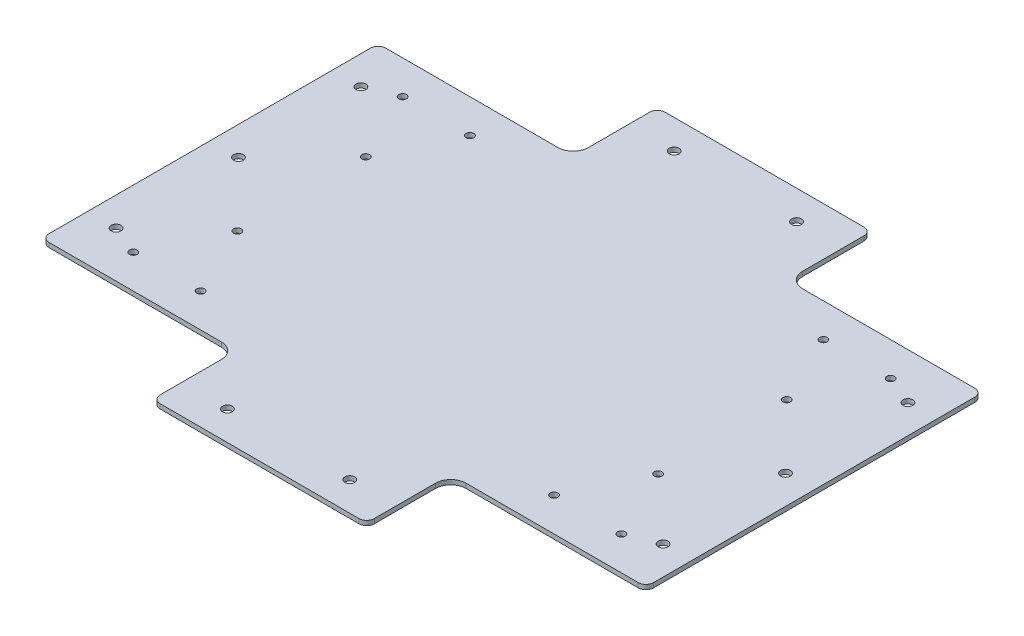
from build123d import *

# Parameters (mm, degrees)
SKETCH_1_R      = 2.5
SKETCH_1_R_2    = 3.2
EXTRUDE_1_DEPTH = 3


with BuildPart() as part:
    # Эскиз1 → Бобышка-Вытянуть1 (new body)
    with BuildSketch(Plane(origin=(0, 0, 0), x_dir=(1, 0, 0), z_dir=(0, 1, 0))):
        with BuildLine():
            ThreePointArc((-70, -160), (-68.535533906, -163.535533906), (-65, -165))
            Line((-65, -165), (65, -165))
            ThreePointArc((65, -165), (68.535533906, -163.535533906), (70, -160))
            Line((70, -160), (70, -120))
            ThreePointArc((70, -120), (72.928932188, -112.928932188), (80, -110))
            Line((80, -110), (134.901841239, -110))
            Line((134.901841239, -110), (160.901841239, -110))
            Line((160.901841239, -110), (192.5, -110))
            ThreePointArc((192.5, -110), (196.035533906, -108.535533906), (197.5, -105))
            Line((197.5, -105), (197.5, 105))
            ThreePointArc((197.5, 105), (196.035533906, 108.535533906), (192.5, 110))
            Line((192.5, 110), (160.901841239, 110))
            Line((160.901841239, 110), (134.901841239, 110))
            Line((134.901841239, 110), (80, 110))
            ThreePointArc((80, 110), (72.928932188, 112.928932188), (70, 120))
            Line((70, 120), (70, 160))
            ThreePointArc((70, 160), (68.535533906, 163.535533906), (65, 165))
            Line((65, 165), (-65, 165))
            ThreePointArc((-65, 165), (-68.535533906, 163.535533906), (-70, 160))
            Line((-70, 160), (-70, 120))
            ThreePointArc((-70, 120), (-72.928932188, 112.928932188), (-80, 110))
            Line((-80, 110), (-134.901841239, 110))
            Line((-134.901841239, 110), (-160.901841239, 110))
            Line((-160.901841239, 110), (-192.5, 110))
            ThreePointArc((-192.5, 110), (-196.035533906, 108.535533906), (-197.5, 105))
            Line((-197.5, 105), (-197.5, -105))
            ThreePointArc((-197.5, -105), (-196.035533906, -108.535533906), (-192.5, -110))
            Line((-192.5, -110), (-80, -110))
            ThreePointArc((-80, -110), (-72.928932188, -112.928932188), (-70, -120))
            Line((-70, -120), (-70, -160))
        make_face()
        with Locations((-159.5, -88)):
            Circle(SKETCH_1_R, mode=Mode.SUBTRACT)
        with Locations((-115.5, -88)):
            Circle(SKETCH_1_R, mode=Mode.SUBTRACT)
        with Locations((-40, -146)):
            Circle(SKETCH_1_R_2, mode=Mode.SUBTRACT)
        with Locations((-178.768667216, -80)):
            Circle(SKETCH_1_R_2, mode=Mode.SUBTRACT)
        with Locations((-137.5, -42)):
            Circle(SKETCH_1_R, mode=Mode.SUBTRACT)
        with Locations((40, -146)):
            Circle(SKETCH_1_R_2, mode=Mode.SUBTRACT)
        with Locations((115.5, -88)):
            Circle(SKETCH_1_R, mode=Mode.SUBTRACT)
        with Locations((159.5, -88)):
            Circle(SKETCH_1_R, mode=Mode.SUBTRACT)
        with Locations((137.5, -42)):
            Circle(SKETCH_1_R, mode=Mode.SUBTRACT)
        with Locations((178.768667216, -80)):
            Circle(SKETCH_1_R_2, mode=Mode.SUBTRACT)
        with Locations((-178.768667216, 0)):
            Circle(SKETCH_1_R_2, mode=Mode.SUBTRACT)
        with Locations((-178.768667216, 80)):
            Circle(SKETCH_1_R_2, mode=Mode.SUBTRACT)
        with Locations((-137.5, 42)):
            Circle(SKETCH_1_R, mode=Mode.SUBTRACT)
        with Locations((-159.5, 88)):
            Circle(SKETCH_1_R, mode=Mode.SUBTRACT)
        with Locations((-115.5, 88)):
            Circle(SKETCH_1_R, mode=Mode.SUBTRACT)
        with Locations((-40, 146)):
            Circle(SKETCH_1_R_2, mode=Mode.SUBTRACT)
        with Locations((178.768667216, 0)):
            Circle(SKETCH_1_R_2, mode=Mode.SUBTRACT)
        with Locations((137.5, 42)):
            Circle(SKETCH_1_R, mode=Mode.SUBTRACT)
        with Locations((178.768667216, 80)):
            Circle(SKETCH_1_R_2, mode=Mode.SUBTRACT)
        with Locations((40, 146)):
            Circle(SKETCH_1_R_2, mode=Mode.SUBTRACT)
        with Locations((115.5, 88)):
            Circle(SKETCH_1_R, mode=Mode.SUBTRACT)
        with Locations((159.5, 88)):
            Circle(SKETCH_1_R, mode=Mode.SUBTRACT)
    extrude(amount=EXTRUDE_1_DEPTH)


solid = part.part
